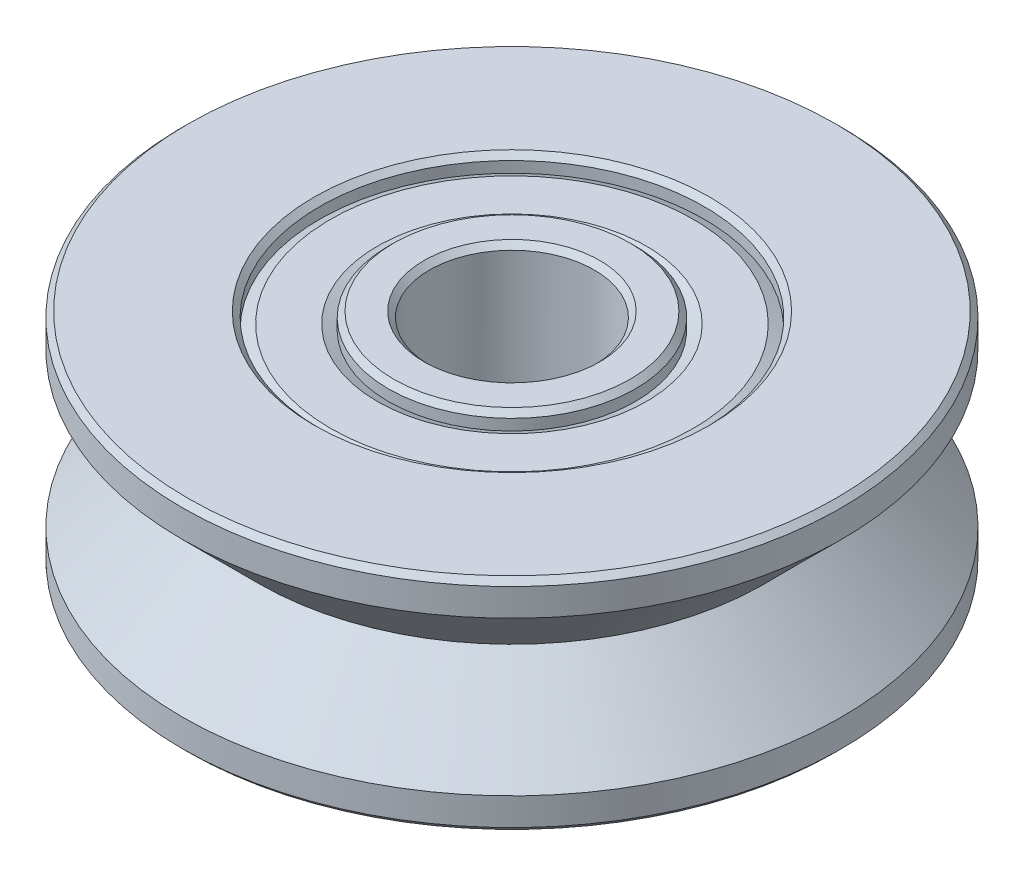
from build123d import *

# Parameters (mm, degrees)
CHAMFER1_SIZE = 0.1


with BuildPart() as part:
    # Sketch1 → Revolve1 (revolve)
    with BuildSketch(Plane(origin=(0, 0, 0), x_dir=(0, 0, -1), z_dir=(1, 0, 0))):
        Polygon((4.6, 0), (6, 1.4), (6, 2), (1.5, 2), (1.5, -2), (6, -2), (6, -1.4), align=None)
    revolve(axis=Axis((0, 2, 0), (0, -1, 0)))

    # Sketch3 → Cut-Revolve2 (revolve, cut)
    with BuildSketch(Plane(origin=(0, 0, 0), x_dir=(0, 0, -1), z_dir=(1, 0, 0))):
        Polygon((3.5, 2), (2.25, 2), (2.25, 1.7), (2.45, 1.8), (3.3, 1.8), (3.5, 1.7), align=None)
    cut_revolve2 = revolve(axis=Axis((0, 2, 0), (0, -1, 0)), mode=Mode.SUBTRACT)

    # Mirror1: Cut-Revolve2 across plane
    add(cut_revolve2.mirror(Plane.ZX), mode=Mode.SUBTRACT)

    # Chamfer1
    chamfer1_edges = [part.edges().sort_by_distance(p)[0] for p in [
        (0, -2, 3.5),
        (0, 2, 3.5),
        (0, -2, 6),
        (0, 2, 6),
        (0, -2, 2.25),
        (0, 2, 2.25),
        (0, 2, 1.5),
        (0, -2, 1.5),
    ]]
    chamfer(chamfer1_edges, length=CHAMFER1_SIZE)


solid = part.part
